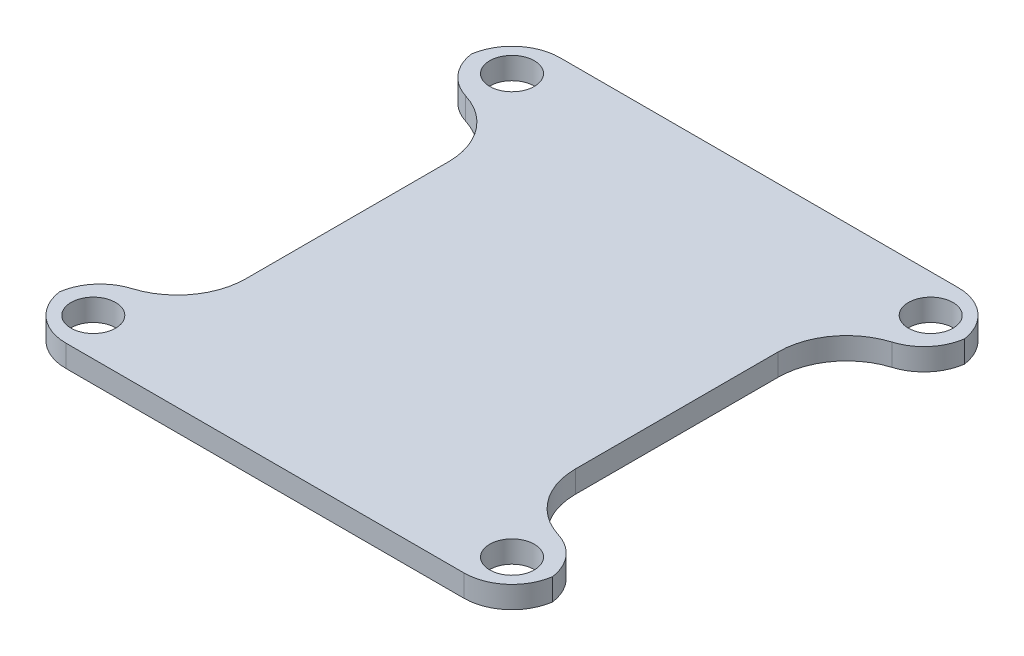
from build123d import *

# Parameters (mm, degrees)
SKETCH1_W           = 24
SKETCH1_H           = 6
SKETCH1_H_2         = 24
SKETCH1_W_2         = 6
SKETCH1_R           = 1.625
BOSS_EXTRUDE1_DEPTH = 1.6
FILLET1_R           = 3.5
FILLET2_R           = 5


with BuildPart() as part:
    # Sketch1 → Boss-Extrude1 (new body)
    # profile 1 of 7: a face of its own
    with BuildSketch(Plane(origin=(0, 0, 0), x_dir=(1, 0, 0), z_dir=(0, 1, 0))):
        with Locations((0, 15)):
            Rectangle(SKETCH1_W, SKETCH1_H)
    # profile 2 of 7: a face of its own
    with BuildSketch(Plane(origin=(0, 0, 0), x_dir=(1, 0, 0), z_dir=(0, 1, 0))):
        Rectangle(SKETCH1_W, SKETCH1_H_2)
    # profile 3 of 7: a face of its own
    with BuildSketch(Plane(origin=(0, 0, 0), x_dir=(1, 0, 0), z_dir=(0, 1, 0))):
        with Locations((15, -15)):
            Rectangle(SKETCH1_W_2, SKETCH1_H)
        with Locations(Location((15.25, -15.25, 0), (0, 0, 270))):
            Circle(SKETCH1_R, mode=Mode.SUBTRACT)
    # profile 4 of 7: a face of its own
    with BuildSketch(Plane(origin=(0, 0, 0), x_dir=(1, 0, 0), z_dir=(0, 1, 0))):
        with Locations((0, -15)):
            Rectangle(SKETCH1_W, SKETCH1_H)
    # profile 5 of 7: a face of its own
    with BuildSketch(Plane(origin=(0, 0, 0), x_dir=(1, 0, 0), z_dir=(0, 1, 0))):
        with Locations((-15, -15)):
            Rectangle(SKETCH1_W_2, SKETCH1_H)
        with Locations(Location((-15.25, -15.25, 0), (0, 0, 270))):
            Circle(SKETCH1_R, mode=Mode.SUBTRACT)
    # profile 6 of 7: a face of its own
    with BuildSketch(Plane(origin=(0, 0, 0), x_dir=(1, 0, 0), z_dir=(0, 1, 0))):
        with Locations((15, 15)):
            Rectangle(SKETCH1_W_2, SKETCH1_H)
        with Locations(Location((15.25, 15.25, 0), (0, 0, 270))):
            Circle(SKETCH1_R, mode=Mode.SUBTRACT)
    # profile 7 of 7: a face of its own
    with BuildSketch(Plane(origin=(0, 0, 0), x_dir=(1, 0, 0), z_dir=(0, 1, 0))):
        with Locations((-15, 15)):
            Rectangle(SKETCH1_W_2, SKETCH1_H)
        with Locations(Location((-15.25, 15.25, 0), (0, 0, 270))):
            Circle(SKETCH1_R, mode=Mode.SUBTRACT)
    extrude(amount=BOSS_EXTRUDE1_DEPTH)

    # Fillet1
    # the kernel refuses this fillet: 3.5 mm, written as the material it takes off along each edge
    with BuildSketch(Plane(origin=(-18, -8.75, 12), x_dir=(1, 0, 0), z_dir=(0, 1, 0)), Plane(origin=(-18, -8.75, -12), x_dir=(0, 0, -1), z_dir=(0, 1, 0)), Plane(origin=(18, -8.75, -12), x_dir=(-1, 0, 0), z_dir=(0, 1, 0)), Plane(origin=(18, -8.75, 12), x_dir=(0, 0, 1), z_dir=(0, 1, 0)), Plane(origin=(18, -8.75, 18), x_dir=(-1, 0, 0), z_dir=(0, 1, 0)), Plane(origin=(-18, -8.75, 18), x_dir=(0, 0, -1), z_dir=(0, 1, 0)), Plane(origin=(-18, -8.75, -18), x_dir=(1, 0, 0), z_dir=(0, 1, 0))) as fillet1_piece_1:
        with BuildLine():
            CenterArc((FILLET1_R, -FILLET1_R), FILLET1_R, 90, 90)
            Line((0, -FILLET1_R), (0, 0))
            Line((0, 0), (FILLET1_R, 0))
        make_face()
    extrude(amount=19.1, mode=Mode.SUBTRACT)
    with BuildSketch(Plane(origin=(18, -8.75, -18), x_dir=(-1, 0, 0), z_dir=(0, 1, 0))) as fillet1_piece_2:
        with BuildLine():
            CenterArc((FILLET1_R, FILLET1_R), FILLET1_R, 180, 90)
            Line((0, FILLET1_R), (0, 0))
            Line((0, 0), (FILLET1_R, 0))
        make_face()
    extrude(amount=19.1, mode=Mode.SUBTRACT)

    # Fillet2
    fillet2_edges = [part.edges().sort_by_distance(p)[0] for p in [
        (12, 0.8, -12),
        (12, 0.8, 12),
        (-12, 0.8, 12),
        (-12, 0.8, -12),
    ]]
    fillet(fillet2_edges, radius=FILLET2_R)


solid = part.part
